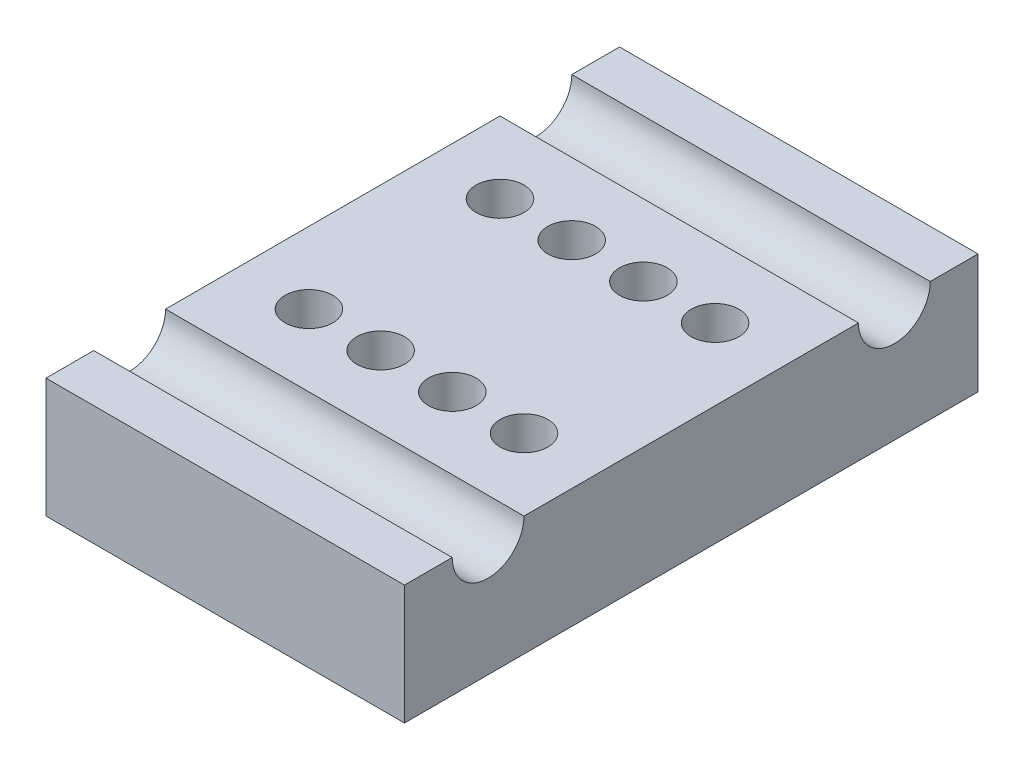
from build123d import *

# Parameters (mm, degrees)
SKETCH_1_W          = 30
SKETCH_1_H          = 10
EXTRUDE_1_DEPTH     = 48
SKETCH_3_R          = 3.005
CUT_EXTRUDE_1_DEPTH = 48
SKETCH_4_R          = 2
CUT_EXTRUDE_2_DEPTH = 58.480431453


with BuildPart() as part:
    # 草图1 → 凸台-拉伸1 (new body)
    with BuildSketch(Plane.XY):
        with Locations((15, 5)):
            Rectangle(SKETCH_1_W, SKETCH_1_H)
    extrude(amount=EXTRUDE_1_DEPTH)

    # 草图3 → 切除-拉伸1 (cut)
    with BuildSketch(Plane.ZY):
        with Locations((7, 10)):
            Circle(SKETCH_3_R)
        with Locations((41, 10)):
            Circle(SKETCH_3_R)
    extrude(amount=-CUT_EXTRUDE_1_DEPTH, mode=Mode.SUBTRACT)

    # 草图4 → 切除-拉伸2 (cut, through all)
    with BuildSketch(Plane(origin=(0, 10, 0), x_dir=(1, 0, 0), z_dir=(0, 1, 0))):
        with Locations((24, -31.995)):
            Circle(SKETCH_4_R)
        with Locations((18, -31.995)):
            Circle(SKETCH_4_R)
        with Locations((12, -31.995)):
            Circle(SKETCH_4_R)
        with Locations((6, -31.995)):
            Circle(SKETCH_4_R)
        with Locations((24, -16.005)):
            Circle(SKETCH_4_R)
        with Locations((18, -16.005)):
            Circle(SKETCH_4_R)
        with Locations((12, -16.005)):
            Circle(SKETCH_4_R)
        with Locations((6, -16.005)):
            Circle(SKETCH_4_R)
    extrude(amount=-CUT_EXTRUDE_2_DEPTH, mode=Mode.SUBTRACT)


solid = part.part
